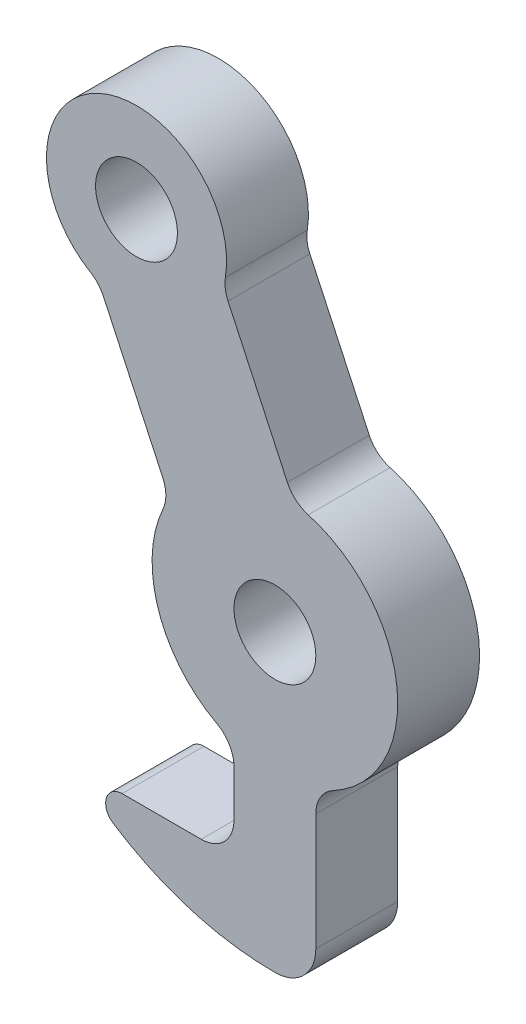
from build123d import *

# Parameters (mm, degrees)
SKETCH1_R           = 3.175
BOSS_EXTRUDE1_DEPTH = 3.175
FILLET1_R           = 2.54
FILLET2_R           = 1.27


with BuildPart() as part:
    # Sketch1 → Boss-Extrude1 (new, symmetric)
    with BuildSketch(Plane.XY):
        with BuildLine():
            Line((1.499199331, 9.406275903), (-3.9943168, 21.187159265))
            ThreePointArc((-3.9943168, 21.187159265), (-13.686492406, 29.350777683), (-13.662808272, 16.678667649))
            Line((-13.662808272, 16.678667649), (-8.169292141, 4.897784287))
            ThreePointArc((-8.169292141, 4.897784287), (-8.962323495, -3.225272479), (-3.175, -8.980256121))
            Line((-3.175, -8.980256121), (-3.175, -16.773611102))
            Line((-3.175, -16.773611102), (-15.531438137, -16.773611102))
            ThreePointArc((-15.531438137, -16.773611102), (-8.340708909, -21.284082665), (0, -22.86))
            ThreePointArc((0, -22.86), (2.24506403, -21.93006403), (3.175, -19.685))
            Line((3.175, -19.685), (3.175, -8.980256121))
            ThreePointArc((3.175, -8.980256121), (9.485682623, 0.864552013), (1.499199331, 9.406275903))
        make_face()
        with Locations((-10.734503848, 23.020217791)):
            Circle(SKETCH1_R, mode=Mode.SUBTRACT)
        Circle(SKETCH1_R, mode=Mode.SUBTRACT)
    extrude(amount=BOSS_EXTRUDE1_DEPTH, both=True)

    # Fillet1
    fillet1_edges = [part.edges().sort_by_distance(p)[0] for p in [
        (-3.9943168, 21.187159265, 0),
        (-13.662808272, 16.678667649, 0),
        (-8.169292141, 4.897784287, 0),
        (1.499199331, 9.406275903, 0),
        (3.175, -8.980256121, 0),
        (-3.175, -8.980256121, 0),
        (-3.175, -16.773611102, 0),
    ]]
    fillet(fillet1_edges, radius=FILLET1_R)

    # Fillet2
    fillet2_edges = [part.edges().sort_by_distance(p)[0] for p in [
        (-15.531438137, -16.773611102, 0),
    ]]
    fillet(fillet2_edges, radius=FILLET2_R)


solid = part.part
